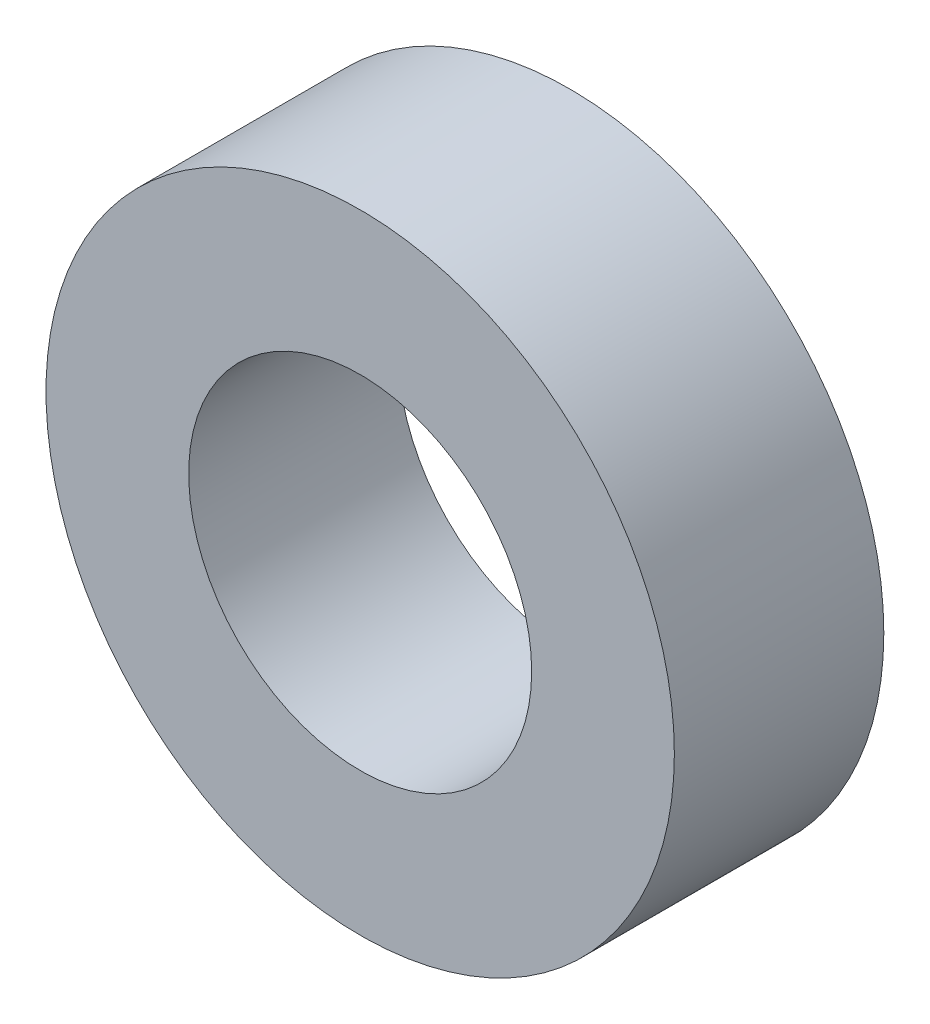
from build123d import *

# Parameters (mm, degrees)
SKETCH1_R           = 3
SKETCH1_R_2         = 1.6375
BOSS_EXTRUDE1_DEPTH = 2


with BuildPart() as part:
    # Sketch1 → Boss-Extrude1 (new body)
    with BuildSketch(Plane.XY):
        Circle(SKETCH1_R)
        Circle(SKETCH1_R_2, mode=Mode.SUBTRACT)
    extrude(amount=BOSS_EXTRUDE1_DEPTH)


solid = part.part
